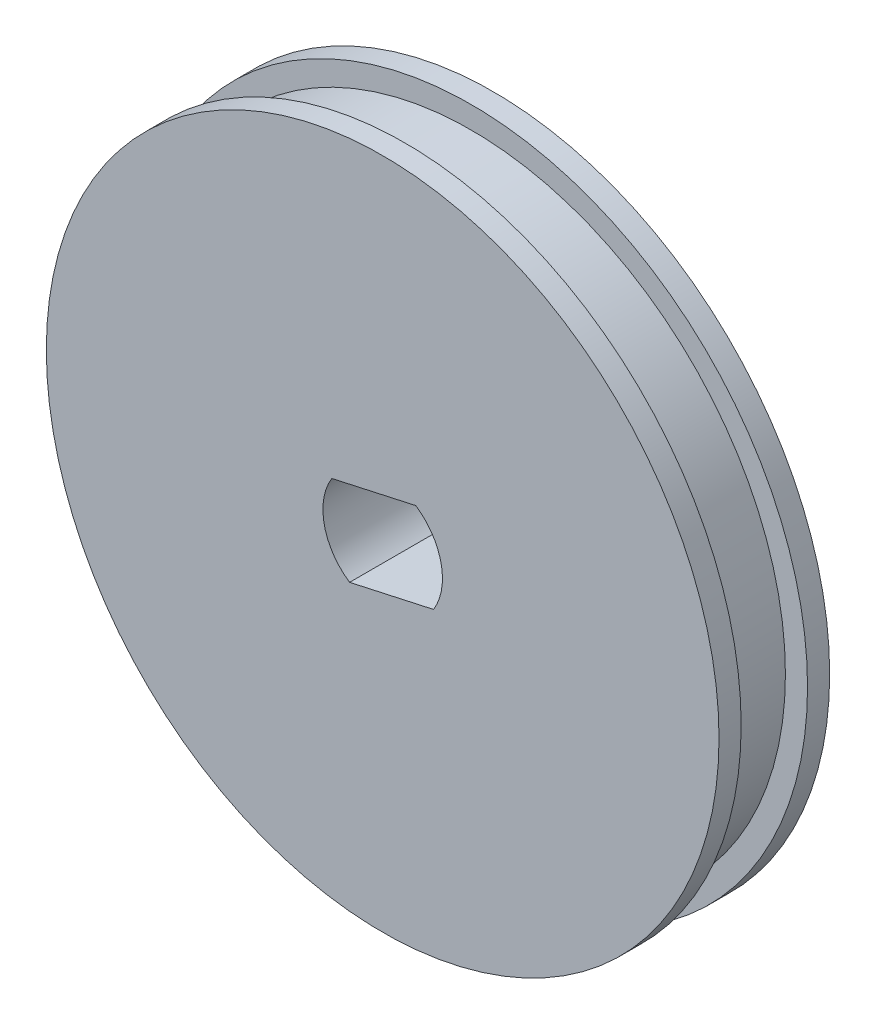
from build123d import *

# Parameters (mm, degrees)
SKETCH_1_R          = 14.2
EXTRUDE_1_DEPTH     = 1.5
SKETCH_2_R          = 15.2
EXTRUDE_2_DEPTH     = 1
CUT_EXTRUDE_1_DEPTH = 48.703848185


with BuildPart() as part:
    # 草图1 → 凸台-拉伸1 (new, symmetric)
    with BuildSketch(Plane.XY):
        with Locations((22.416532439, -13.707674049)):
            Circle(SKETCH_1_R)
    extrude(amount=EXTRUDE_1_DEPTH, both=True)

    # 草图2 → 凸台-拉伸2 (add)
    with BuildSketch(Plane.XY.offset(1.5)):
        with Locations((22.416532439, -13.707674049)):
            Circle(SKETCH_2_R)
    extrude_2 = extrude(amount=EXTRUDE_2_DEPTH)

    # 镜向1: 凸台-拉伸2 across plane
    add(extrude_2.mirror(Plane.XY))

    # 草图3 → 切除-拉伸1 (cut, through all)
    with BuildSketch(Plane.XY.offset(2.5)):
        with BuildLine():
            Line((23.910655447, -11.458763994), (20.116007288, -12.294314919))
            ThreePointArc((20.116007288, -12.294314919), (19.779698626, -14.288283591), (20.92240943, -15.956584104))
            Line((20.92240943, -15.956584104), (24.71705759, -15.121033179))
            ThreePointArc((24.71705759, -15.121033179), (25.053366252, -13.127064506), (23.910655447, -11.458763994))
        make_face()
    extrude(amount=-CUT_EXTRUDE_1_DEPTH, mode=Mode.SUBTRACT)


solid = part.part
